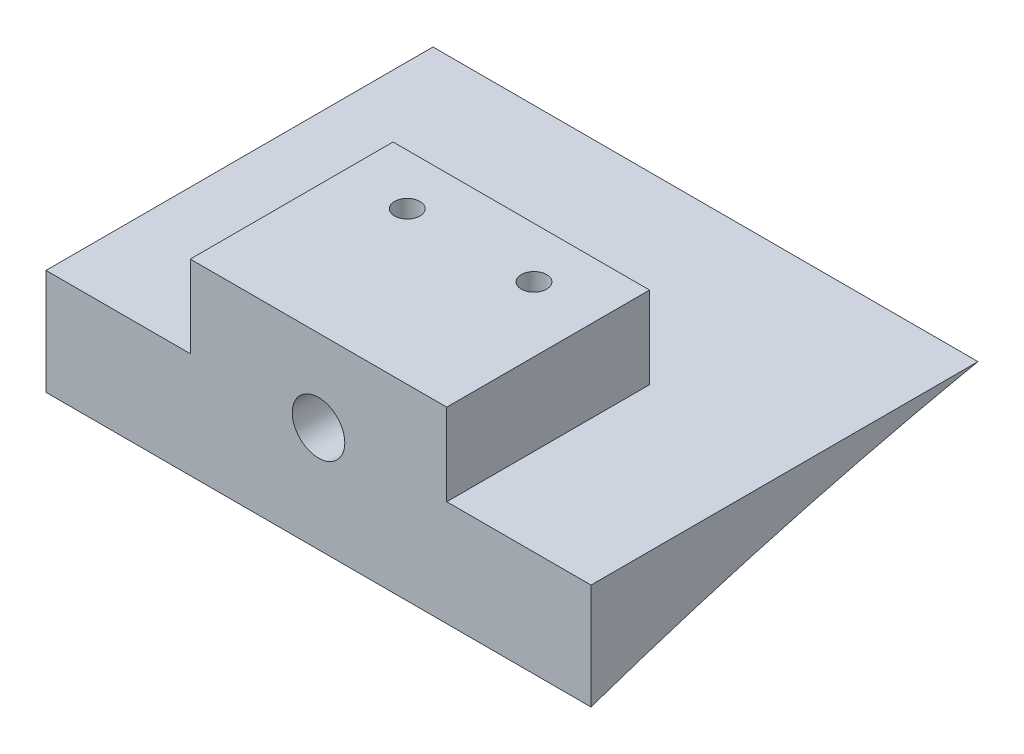
from build123d import *

# Parameters (mm, degrees)
BOSS_EXTRUDE1_DEPTH     = 68.2625
SKETCH4_W               = 64.246369732
SKETCH4_H               = 20.526706846
BOSS_EXTRUDE2_DEPTH     = 50.8
CUT_EXTRUDE1_DEPTH      = 364.143790643
CUT_EXTRUDE1_DEPTH_BACK = 364.143790643
SKETCH2_R               = 3.175
SKETCH5_R               = 6.582805395
CUT_EXTRUDE2_DEPTH      = 12.7


with BuildPart() as part:
    # Sketch1 → Boss-Extrude1 (new, symmetric)
    with BuildSketch(Plane(origin=(0, 0, 0), x_dir=(0, 0, -1), z_dir=(1, 0, 0))):
        with BuildLine():
            Line((-258.749759613, 26.462577976), (-355.687187923, 26.462577976))
            Line((-355.687187923, 26.462577976), (-355.687187923, 0))
            add(Edge.make_bspline(
                [(-355.687187923, 0), (-355.37055154, 0.107976188), (-354.108976481, 0.538185956), (-351.284999827, 1.502859463), (-346.602313416, 3.058862652), (-336.815361237, 6.25189344), (-320.429894612, 11.27779725), (-301.357119069, 16.549630187), (-283.167308194, 21.086195797), (-270.107851124, 24.071552001), (-261.828911243, 25.828285388), (-258.749759613, 26.462577976)],
                knots=[0, 0, 0, 0, 0.001371577, 0.005464776, 0.012234802, 0.021601969, 0.04767125, 0.082496261, 0.102719149, 0.124527079, 0.137415965, 0.137415965, 0.137415965, 0.137415965], degree=3))
        make_face()
    extrude(amount=BOSS_EXTRUDE1_DEPTH, both=True)

    # Sketch4 → Boss-Extrude2 (add)
    with BuildSketch(Plane.XY.offset(355.687187923)):
        with Locations((0, 36.725931399)):
            Rectangle(SKETCH4_W, SKETCH4_H)
    extrude(amount=-BOSS_EXTRUDE2_DEPTH)

    # Sketch2 → Cut-Extrude1 (cut, two sides: drawn at the far end of the back side and taken through both)
    with BuildSketch(Plane(origin=(0, 26.462577976, 0), x_dir=(1, 0, 0), z_dir=(0, 1, 0)).offset(-CUT_EXTRUDE1_DEPTH_BACK)):
        with Locations((-15.875, -317.587187923)):
            Circle(SKETCH2_R)
        with Locations((15.875, -317.587187923)):
            Circle(SKETCH2_R)
    extrude(amount=CUT_EXTRUDE1_DEPTH + CUT_EXTRUDE1_DEPTH_BACK, mode=Mode.SUBTRACT)

    # Sketch5 → Cut-Extrude2 (cut)
    with BuildSketch(Plane.XY.offset(355.687187923)):
        with Locations((0, 26.462577976)):
            Circle(SKETCH5_R)
    extrude(amount=-CUT_EXTRUDE2_DEPTH, mode=Mode.SUBTRACT)


solid = part.part
